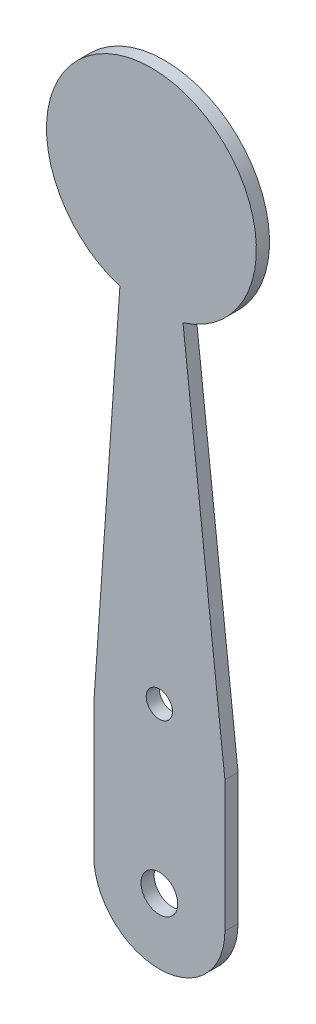
from build123d import *

# Parameters (mm, degrees)
MODEL_R           = 1.4
MODEL_R_2         = 1
BRIDA_BASE1_DEPTH = 1


# Sheet-metal steps are written as plain solids
with BuildPart() as part:
    # Model → Brida base1 (new body)
    with BuildSketch(Plane.XY):
        with BuildLine():
            Line((40.2059904, -5.7615616), (42.197855138, 22.819737764))
            ThreePointArc((42.197855138, 22.819737764), (44.604363348, 38.449201588), (47.010871557, 22.819737764))
            Line((47.010871557, 22.819737764), (50.2059904, -5.7615616))
            Line((50.2059904, -5.7615616), (50.2059904, -15.7615616))
            ThreePointArc((50.2059904, -15.7615616), (45.2059904, -20.7615616), (40.2059904, -15.7615616))
            Line((40.2059904, -15.7615616), (40.2059904, -5.7615616))
        make_face()
        with Locations((45.2059904, -15.7615616)):
            Circle(MODEL_R, mode=Mode.SUBTRACT)
        with Locations((45.2059904, -3.2615616)):
            Circle(MODEL_R_2, mode=Mode.SUBTRACT)
    extrude(amount=-BRIDA_BASE1_DEPTH)


solid = part.part
